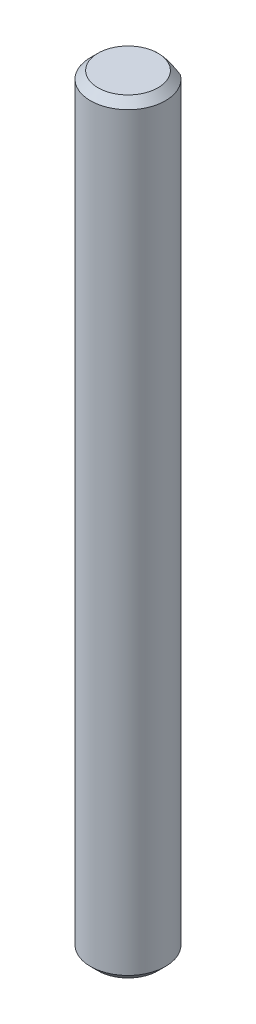
from build123d import *

# Parameters (mm, degrees)
SKETCH_1_R          = 2.5
EXTRUDE_1_DEPTH     = 51
CUT_EXTRUDE_START   = -15
CUT_EXTRUDE_1_DEPTH = 15
CHAMFER_1_SIZE      = 0.5


with BuildPart() as part:
    # Эскиз1 → Бобышка-Вытянуть1 (new body)
    with BuildSketch(Plane(origin=(0, 0, 0), x_dir=(1, 0, 0), z_dir=(0, 1, 0))):
        with Locations(Location((0, 0, 0), (0, 0, 270))):
            Circle(SKETCH_1_R)
    extrude(amount=EXTRUDE_1_DEPTH)

    # Эскиз2 → Вырез-Вытянуть1 (cut)
    with BuildSketch(Plane(origin=(0, 51, 0), x_dir=(1, 0, 0), z_dir=(0, 1, 0)).offset(CUT_EXTRUDE_START)):
        with BuildLine():
            Line((-1.5, 2), (1.5, 2))
            ThreePointArc((1.5, 2), (0, 2.5), (-1.5, 2))
        make_face()
    extrude(amount=CUT_EXTRUDE_1_DEPTH, mode=Mode.SUBTRACT)

    # Фаска1
    chamfer_1_edges = [part.edges().sort_by_distance(p)[0] for p in [
        (-2.371708245, 51, 0.790569415),
        (0, 0, -2.5),
    ]]
    chamfer(chamfer_1_edges, length=CHAMFER_1_SIZE - 0.0001)  # a hair under: the kernel refuses the full size


solid = part.part
